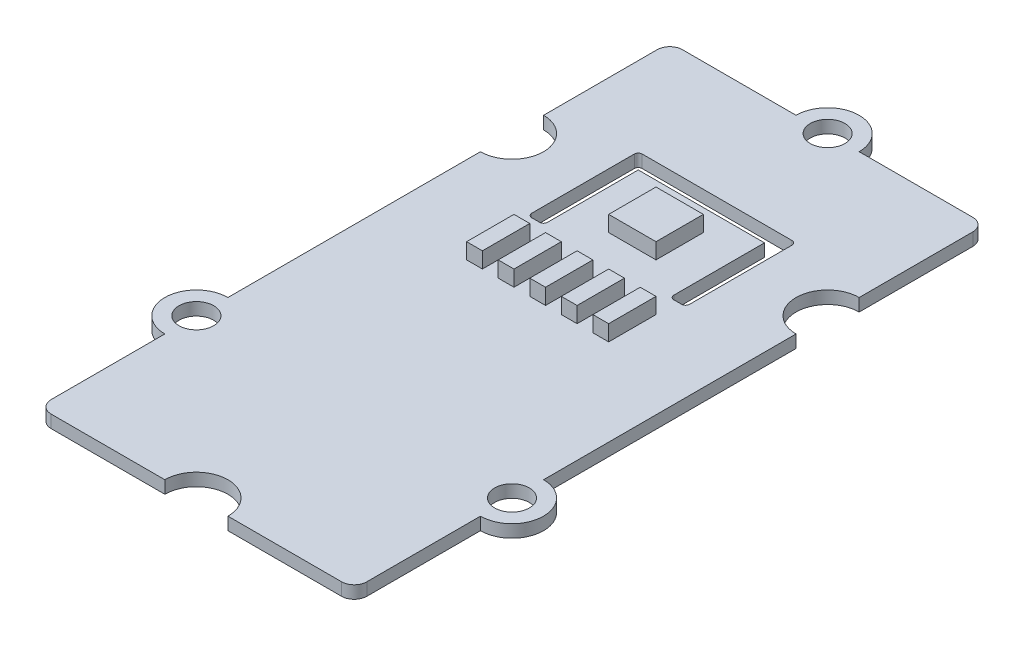
from build123d import *

# Parameters (mm, degrees)
SKETCH1_R        = 1.1
BOARD_DEPTH      = 0.8
U_CUT_DEPTH      = 48.419827077
U_CUT_DEPTH_BACK = 48.419827077
SKETCH3_W        = 3
SKETCH3_H        = 3
SKETCH3_W_2      = 1
SMDS_DEPTH       = 1


with BuildPart() as part:
    # Sketch1 → Board (new body)
    with BuildSketch(Plane(origin=(0, 0, 0), x_dir=(1, 0, 0), z_dir=(0, 1, 0))):
        with BuildLine():
            Line((0.8, 0), (8, 0))
            ThreePointArc((8, 0), (10, 2), (12, 0))
            Line((12, 0), (19.2, 0))
            ThreePointArc((19.2, 0), (19.765685425, 0.234314575), (20, 0.8))
            Line((20, 0.8), (20, 8))
            ThreePointArc((20, 8), (22, 10), (20, 12))
            Line((20, 12), (20, 28))
            ThreePointArc((20, 28), (18, 30), (20, 32))
            Line((20, 32), (20, 39.2))
            ThreePointArc((20, 39.2), (19.765685425, 39.765685425), (19.2, 40))
            Line((19.2, 40), (12, 40))
            ThreePointArc((12, 40), (10, 42), (8, 40))
            Line((8, 40), (0.8, 40))
            ThreePointArc((0.8, 40), (0.234314575, 39.765685425), (0, 39.2))
            Line((0, 39.2), (0, 32))
            ThreePointArc((0, 32), (2, 30), (0, 28))
            Line((0, 28), (0, 12))
            ThreePointArc((0, 12), (-2, 10), (0, 8))
            Line((0, 8), (0, 0.8))
            ThreePointArc((0, 0.8), (0.234314575, 0.234314575), (0.8, 0))
        make_face()
        with Locations((10, 40)):
            Circle(SKETCH1_R, mode=Mode.SUBTRACT)
        with Locations((0, 10)):
            Circle(SKETCH1_R, mode=Mode.SUBTRACT)
        with Locations((20, 10)):
            Circle(SKETCH1_R, mode=Mode.SUBTRACT)
    extrude(amount=BOARD_DEPTH)

    # Sketch2 → U-cut (cut, two sides: drawn at the far end of the back side and taken through both)
    with BuildSketch(Plane(origin=(0, 0.8, 0), x_dir=(1, 0, 0), z_dir=(0, 1, 0)).offset(-U_CUT_DEPTH_BACK)):
        with BuildLine():
            Line((14.25, 26), (14.75, 26))
            ThreePointArc((14.75, 26), (14.926776695, 26.073223305), (15, 26.25))
            Line((15, 26.25), (15, 32.75))
            ThreePointArc((15, 32.75), (14.926776695, 32.926776695), (14.75, 33))
            Line((14.75, 33), (5.25, 33))
            ThreePointArc((5.25, 33), (5.073223305, 32.926776695), (5, 32.75))
            Line((5, 32.75), (5, 26.25))
            ThreePointArc((5, 26.25), (5.073223305, 26.073223305), (5.25, 26))
            Line((5.25, 26), (5.75, 26))
            ThreePointArc((5.75, 26), (5.926776695, 26.073223305), (6, 26.25))
            Line((6, 26.25), (6, 32))
            Line((6, 32), (14, 32))
            Line((14, 32), (14, 26.25))
            ThreePointArc((14, 26.25), (14.073223305, 26.073223305), (14.25, 26))
        make_face()
    extrude(amount=U_CUT_DEPTH + U_CUT_DEPTH_BACK, mode=Mode.SUBTRACT)

    # Sketch3 → SMDs (add)
    with BuildSketch(Plane(origin=(0, 0.8, 0), x_dir=(1, 0, 0), z_dir=(0, 1, 0))):
        with Locations((10, 29.125)):
            Rectangle(SKETCH3_W, SKETCH3_H)
        with Locations((10, 23.125)):
            Rectangle(SKETCH3_W_2, SKETCH3_H)
        with Locations((12, 23.125)):
            Rectangle(SKETCH3_W_2, SKETCH3_H)
        with Locations((14, 23.125)):
            Rectangle(SKETCH3_W_2, SKETCH3_H)
        with Locations((8, 23.125)):
            Rectangle(SKETCH3_W_2, SKETCH3_H)
        with Locations((6, 23.125)):
            Rectangle(SKETCH3_W_2, SKETCH3_H)
    extrude(amount=SMDS_DEPTH)


solid = part.part
